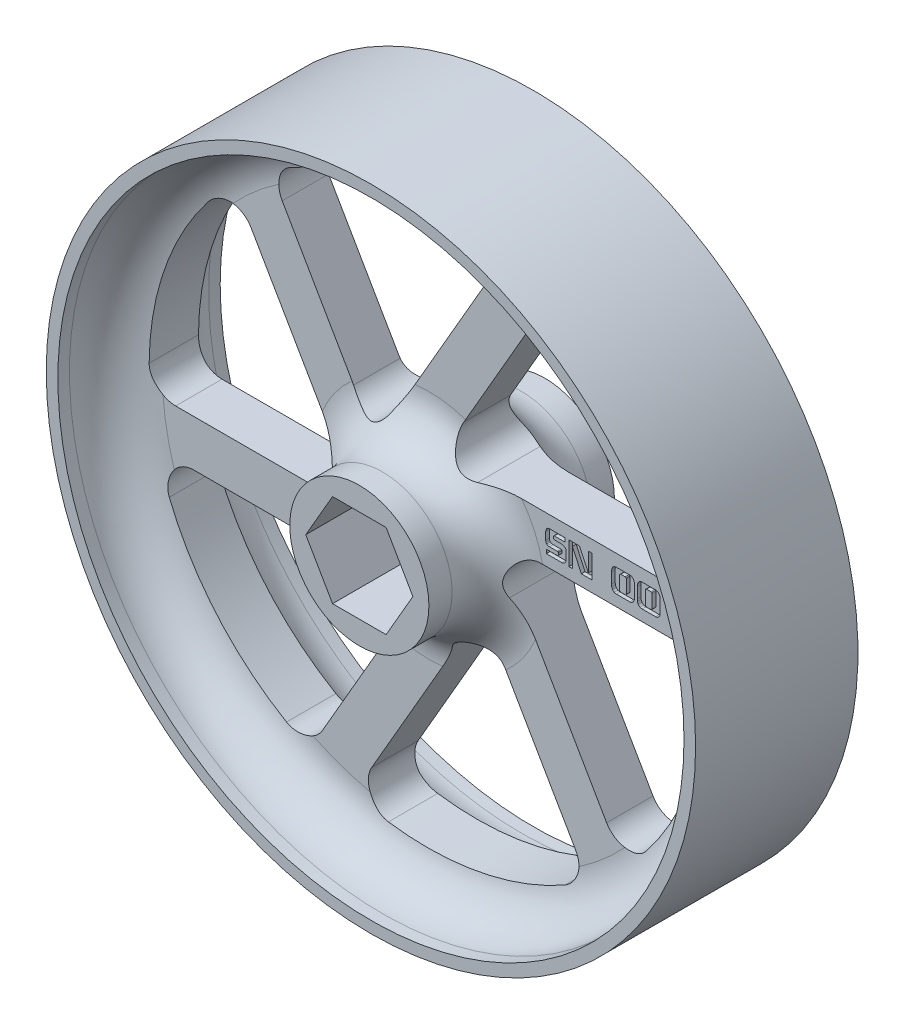
from build123d import *

# Parameters (mm, degrees)
SKETCH1_R           = 44.45
BOSS_EXTRUDE1_DEPTH = 12.7
SKETCH3_OUTSIDE_W   = 116.552
SKETCH3_OUTSIDE_H   = 116.552
SKETCH3_OUTSIDE_R   = 27.132432737
CUT_EXTRUDE1_DEPTH  = 1.5875
CUT_EXTRUDE2_DEPTH  = 65.835334695
CIRPATTERN1_COUNT   = 6
CUT_EXTRUDE3_DEPTH  = 0.508


with BuildPart() as part:
    # Sketch1 → Boss-Extrude1 (new, symmetric)
    with BuildSketch(Plane.XY):
        Circle(SKETCH1_R)
        Polygon((3.666174209, -6.35), (7.332348419, 0), (3.666174209, 6.35), (-3.666174209, 6.35), (-7.332348419, 0), (-3.666174209, -6.35), align=None, mode=Mode.SUBTRACT)
    extrude(amount=BOSS_EXTRUDE1_DEPTH, both=True)

    # Sketch2 → Cut-Revolve1 (revolve, cut)
    with BuildSketch(Plane(origin=(0, 0, 0), x_dir=(1, 0, 0), z_dir=(0, 1, 0))):
        with BuildLine():
            Line((-36.5125, 3.175), (-15.875, 3.175))
            ThreePointArc((-15.875, 3.175), (-11.384871939, 5.034871939), (-9.525, 9.525))
            Line((-9.525, 9.525), (-9.525, 12.7))
            Line((-9.525, 12.7), (-42.8625, 12.7))
            Line((-42.8625, 12.7), (-42.8625, 9.525))
            ThreePointArc((-42.8625, 9.525), (-41.002628061, 5.034871939), (-36.5125, 3.175))
        make_face()
    cut_revolve1 = revolve(axis=Axis((0, 0, 1000), (0, 0, -1)), mode=Mode.SUBTRACT)

    # Mirror1: Cut-Revolve1 across plane
    add(cut_revolve1.mirror(Plane.XY), mode=Mode.SUBTRACT)

    # Sketch3 outside → Cut-Extrude1 (cut)
    with BuildSketch(Plane.XY.offset(12.7)):
        Rectangle(SKETCH3_OUTSIDE_W, SKETCH3_OUTSIDE_H)
        Circle(SKETCH3_OUTSIDE_R, mode=Mode.SUBTRACT)
    cut_extrude1 = extrude(amount=-CUT_EXTRUDE1_DEPTH, mode=Mode.SUBTRACT)

    # Mirror2: Cut-Extrude1 across plane
    add(cut_extrude1.mirror(Plane.XY), mode=Mode.SUBTRACT)

    # Sketch4 → Cut-Extrude2 (cut, symmetric)
    with BuildSketch(Plane.XY.offset(3.175)):
        with BuildLine():
            Line((15.104637743, 3.175), (34.670069585, 3.175))
            ThreePointArc((34.670069585, 3.175), (37.103604102, 2.161771254), (38.098977565, -0.279120879))
            ThreePointArc((38.098977565, -0.279120879), (35.971949149, -12.555033829), (29.998399784, -23.488422901))
            ThreePointArc((29.998399784, -23.488422901), (27.057541118, -24.794985079), (24.328942694, -23.08896484))
            Line((24.328942694, -23.08896484), (12.135036633, -1.9685))
            ThreePointArc((12.135036633, -1.9685), (12.135036633, 1.4605), (15.104637743, 3.175))
        make_face()
    cut_extrude2 = extrude(amount=CUT_EXTRUDE2_DEPTH, both=True, mode=Mode.SUBTRACT)

    # CirPattern1: Cut-Extrude2 ×6 about axis
    cirpattern1_axis = Axis((0, 0, -1000), (0, 0, -1))
    for i in range(1, CIRPATTERN1_COUNT):
        add(cut_extrude2.rotate(cirpattern1_axis, i * 360 / CIRPATTERN1_COUNT), mode=Mode.SUBTRACT)

    # Sketch5 → Cut-Extrude3 (cut)
    # profile 1 of 5: a face of its own
    with BuildSketch(Plane.XY.offset(3.175)):
        with BuildLine():
            Line((18.656090115, 7.8603666), (18.656090115, 7.338197179))
            Line((18.656090115, 7.338197179), (17.172892801, 7.338197179))
            add(Edge.make_bspline(
                [(17.172892801, 7.338197179), (17.165602463, 7.337935526), (17.150867392, 7.337406679), (17.130305832, 7.329431218), (17.110722272, 7.319519044), (17.098885806, 7.311029967), (17.092861809, 7.306709575)],
                knots=[0, 0, 0, 0, 0.993128326, 2.007289411, 2.985838915, 4, 4, 4, 4], degree=3))
            add(Edge.make_bspline(
                [(17.092861809, 7.306709575), (17.087472204, 7.302043577), (17.076782719, 7.292789259), (17.063326985, 7.276433914), (17.054122899, 7.257046139), (17.053273913, 7.242958055), (17.052846313, 7.235862468)],
                knots=[0, 0, 0, 0, 1.012657379, 2.008456025, 2.996941486, 4, 4, 4, 4], degree=3))
            Line((17.052846313, 7.235862468), (17.052846313, 7.001673418))
            add(Edge.make_bspline(
                [(17.052846313, 7.001673418), (17.053329679, 6.995965129), (17.054292515, 6.98459457), (17.058941222, 6.967500571), (17.067992645, 6.950937734), (17.075677963, 6.940357246), (17.079741974, 6.934762261)],
                knots=[0, 0, 0, 0, 0.9352768, 1.863013687, 2.869957243, 4, 4, 4, 4], degree=3))
            add(Edge.make_bspline(
                [(17.079741974, 6.934762261), (17.08613793, 6.927807871), (17.099503814, 6.913275003), (17.122868199, 6.894856956), (17.149066938, 6.880885323), (17.167940356, 6.878713701), (17.176828751, 6.87769098)],
                knots=[0, 0, 0, 0, 0.978349812, 2.044496878, 3.079060062, 4, 4, 4, 4], degree=3))
            Line((17.176828751, 6.87769098), (18.150976479, 6.87769098))
            add(Edge.make_bspline(
                [(18.150976479, 6.87769098), (18.170904125, 6.877427204), (18.211762983, 6.876886369), (18.273361972, 6.868538165), (18.335387731, 6.859641068), (18.375425675, 6.847973305), (18.395005404, 6.842267427)],
                knots=[0, 0, 0, 0, 0.965648835, 1.979928116, 3.012125609, 4, 4, 4, 4], degree=3))
            add(Edge.make_bspline(
                [(18.395005404, 6.842267427), (18.415368684, 6.835870028), (18.455832787, 6.823157684), (18.512011312, 6.793506109), (18.566431335, 6.761396515), (18.599506316, 6.735295674), (18.616074619, 6.722220939)],
                knots=[0, 0, 0, 0, 1.0093946, 2.005779408, 3.001031929, 4, 4, 4, 4], degree=3))
            add(Edge.make_bspline(
                [(18.616074619, 6.722220939), (18.627584104, 6.710098213), (18.650644386, 6.685809246), (18.682764601, 6.647115443), (18.712869816, 6.605621116), (18.727831053, 6.574671318), (18.735465115, 6.558878997)],
                knots=[0, 0, 0, 0, 0.985997725, 1.975534637, 2.967004323, 4, 4, 4, 4], degree=3))
            add(Edge.make_bspline(
                [(18.735465115, 6.558878997), (18.742500457, 6.541980983), (18.756906647, 6.507379109), (18.769907266, 6.450927756), (18.779043929, 6.3894981), (18.779718026, 6.346596925), (18.780072553, 6.324033956)],
                knots=[0, 0, 0, 0, 0.910556491, 1.864536308, 2.876897876, 4, 4, 4, 4], degree=3))
            Line((18.780072553, 6.324033956), (18.780072553, 5.35447817))
            add(Edge.make_bspline(
                [(18.780072553, 5.35447817), (18.779781746, 5.338071984), (18.779203457, 5.305447217), (18.775762175, 5.257093888), (18.770905331, 5.209718742), (18.765190079, 5.17886068), (18.762360776, 5.163584575)],
                knots=[0, 0, 0, 0, 1.025446132, 2.039166212, 3.02930059, 4, 4, 4, 4], degree=3))
            add(Edge.make_bspline(
                [(18.762360776, 5.163584575), (18.757704072, 5.14197931), (18.748563821, 5.099572159), (18.725120214, 5.04032251), (18.700067981, 4.984428793), (18.679399324, 4.950203897), (18.66920995, 4.933331476)],
                knots=[0, 0, 0, 0, 1.060103802, 2.080788211, 3.053854009, 4, 4, 4, 4], degree=3))
            add(Edge.make_bspline(
                [(18.66920995, 4.933331476), (18.657815794, 4.916824362), (18.63515858, 4.884000058), (18.593838043, 4.840591725), (18.547698833, 4.802183396), (18.513778576, 4.780777333), (18.496684123, 4.769989534)],
                knots=[0, 0, 0, 0, 1.002750716, 1.993964127, 2.98903817, 4, 4, 4, 4], degree=3))
            add(Edge.make_bspline(
                [(18.496684123, 4.769989534), (18.473816507, 4.757712727), (18.427151758, 4.732660089), (18.350282853, 4.707625037), (18.267856197, 4.69313288), (18.211387845, 4.691033745), (18.182464082, 4.689958542)],
                knots=[0, 0, 0, 0, 0.948056558, 1.93464945, 2.942102849, 4, 4, 4, 4], degree=3))
            Line((18.182464082, 4.689958542), (16.078698586, 4.689958542))
            Line((16.078698586, 4.689958542), (16.078698586, 5.216719906))
            Line((16.078698586, 5.216719906), (17.55795995, 5.216719906))
            add(Edge.make_bspline(
                [(17.55795995, 5.216719906), (17.56674803, 5.217057421), (17.584569285, 5.217741863), (17.610848271, 5.224746204), (17.635960275, 5.235156085), (17.651838375, 5.243908022), (17.659638669, 5.248207509)],
                knots=[0, 0, 0, 0, 0.977133511, 1.981518807, 3.00839858, 4, 4, 4, 4], degree=3))
            add(Edge.make_bspline(
                [(17.659638669, 5.248207509), (17.666585733, 5.253031097), (17.680278798, 5.262538668), (17.697803147, 5.280325189), (17.710717689, 5.302329688), (17.712083291, 5.319100161), (17.712773999, 5.327582509)],
                knots=[0, 0, 0, 0, 1.01483829, 2.000304807, 2.98857294, 4, 4, 4, 4], degree=3))
            Line((17.712773999, 5.327582509), (17.712773999, 5.606378997))
            add(Edge.make_bspline(
                [(17.712773999, 5.606378997), (17.712109476, 5.613927317), (17.710726363, 5.629638118), (17.700016713, 5.651551358), (17.685742809, 5.672559002), (17.671401343, 5.681792993), (17.664230611, 5.686409989)],
                knots=[0, 0, 0, 0, 0.924252574, 1.923705996, 2.961852998, 4, 4, 4, 4], degree=3))
            add(Edge.make_bspline(
                [(17.664230611, 5.686409989), (17.658171582, 5.692101069), (17.645918205, 5.70361033), (17.622430787, 5.712684924), (17.599404839, 5.720973775), (17.583398388, 5.721553632), (17.575671726, 5.721833542)],
                knots=[0, 0, 0, 0, 1.011242726, 2.045070071, 3.056312797, 4, 4, 4, 4], degree=3))
            Line((17.575671726, 5.721833542), (16.503781231, 5.721833542))
            add(Edge.make_bspline(
                [(16.503781231, 5.721833542), (16.483625329, 5.722225758), (16.44421553, 5.722992636), (16.387505662, 5.732161769), (16.335589127, 5.743968738), (16.302801471, 5.752992091), (16.287303958, 5.757257096)],
                knots=[0, 0, 0, 0, 1.09773934, 2.146353371, 3.123849744, 4, 4, 4, 4], degree=3))
            add(Edge.make_bspline(
                [(16.287303958, 5.757257096), (16.271680205, 5.763585859), (16.241187269, 5.77593773), (16.198227875, 5.797871454), (16.160585289, 5.824321253), (16.138630903, 5.844485895), (16.127897966, 5.854343873)],
                knots=[0, 0, 0, 0, 1.075488155, 2.099034123, 3.070666432, 4, 4, 4, 4], degree=3))
            add(Edge.make_bspline(
                [(16.127897966, 5.854343873), (16.116478393, 5.866579402), (16.093829201, 5.890846935), (16.064280285, 5.931724386), (16.039724703, 5.977374554), (16.027767345, 6.010510539), (16.021627305, 6.027525691)],
                knots=[0, 0, 0, 0, 0.978603383, 1.940928607, 2.942677836, 4, 4, 4, 4], degree=3))
            add(Edge.make_bspline(
                [(16.021627305, 6.027525691), (16.015935862, 6.044028523), (16.004348332, 6.077627565), (15.995105678, 6.130956967), (15.986780063, 6.186457137), (15.986399023, 6.224504748), (15.986203751, 6.244002964)],
                knots=[0, 0, 0, 0, 0.948711643, 1.931535371, 2.939976289, 4, 4, 4, 4], degree=3))
            Line((15.986203751, 6.244002964), (15.986203751, 7.235862468))
            add(Edge.make_bspline(
                [(15.986203751, 7.235862468), (15.986551451, 7.254031323), (15.987261609, 7.291140211), (15.99424368, 7.347478055), (16.005028856, 7.405018621), (16.016062213, 7.443014802), (16.021627305, 7.462179617)],
                knots=[0, 0, 0, 0, 0.947905268, 1.936044473, 2.958965781, 4, 4, 4, 4], degree=3))
            add(Edge.make_bspline(
                [(16.021627305, 7.462179617), (16.028011807, 7.481140431), (16.040737884, 7.518934575), (16.067033014, 7.573172112), (16.097646823, 7.625012493), (16.120490222, 7.65822707), (16.131833917, 7.674720939)],
                knots=[0, 0, 0, 0, 0.997646174, 1.988584603, 3.001160754, 4, 4, 4, 4], degree=3))
            add(Edge.make_bspline(
                [(16.131833917, 7.674720939), (16.142742574, 7.687847467), (16.164730736, 7.714306105), (16.202673325, 7.750362184), (16.244161272, 7.784353899), (16.275440269, 7.802604482), (16.291239908, 7.811823212)],
                knots=[0, 0, 0, 0, 0.967104699, 1.949355842, 2.964179154, 4, 4, 4, 4], degree=3))
            add(Edge.make_bspline(
                [(16.291239908, 7.811823212), (16.307932562, 7.819007587), (16.341751951, 7.833563165), (16.396038226, 7.848139678), (16.453302601, 7.858690036), (16.492796532, 7.859799847), (16.512965115, 7.8603666)],
                knots=[0, 0, 0, 0, 0.952477468, 1.929723551, 2.942760534, 4, 4, 4, 4], degree=3))
            Line((16.512965115, 7.8603666), (18.656090115, 7.8603666))
        make_face()
    # profile 2 of 5: a face of its own
    with BuildSketch(Plane.XY.offset(3.175)):
        Polygon((19.170387636, 7.869550484), (20.618161396, 7.869550484), (21.822562222, 5.274447179), (21.822562222, 7.869550484), (22.318491974, 7.869550484), (22.318491974, 4.699142427), (20.870718214, 4.699142427), (19.648605611, 7.342133129), (19.648605611, 4.699142427), (19.170387636, 4.699142427), align=None)
    # profile 3 of 5: a face of its own
    with BuildSketch(Plane.XY.offset(3.175)):
        with BuildLine():
            Line((25.674545693, 7.869550484), (27.476554991, 7.869550484))
            add(Edge.make_bspline(
                [(27.476554991, 7.869550484), (27.502421027, 7.868922895), (27.552256648, 7.867713731), (27.623889866, 7.854837165), (27.68985485, 7.838182899), (27.731391049, 7.823495774), (27.751415528, 7.816415154)],
                knots=[0, 0, 0, 0, 1.10160964, 2.122451301, 3.094839283, 4, 4, 4, 4], degree=3))
            add(Edge.make_bspline(
                [(27.751415528, 7.816415154), (27.772702826, 7.805544073), (27.814435719, 7.784231756), (27.871020802, 7.744262684), (27.921978699, 7.69974274), (27.949990089, 7.665098997), (27.96395685, 7.647825278)],
                knots=[0, 0, 0, 0, 1.046184486, 2.051002733, 3.028210291, 4, 4, 4, 4], degree=3))
            add(Edge.make_bspline(
                [(27.96395685, 7.647825278), (27.980692884, 7.626681879), (28.014348669, 7.584162983), (28.050809258, 7.511097772), (28.081561458, 7.43631763), (28.097689517, 7.385118929), (28.105651065, 7.359844906)],
                knots=[0, 0, 0, 0, 0.998596662, 2.00815534, 3.016734276, 4, 4, 4, 4], degree=3))
            add(Edge.make_bspline(
                [(28.105651065, 7.359844906), (28.112280931, 7.333485591), (28.125493863, 7.28095303), (28.136123491, 7.201307064), (28.144205726, 7.122981176), (28.144744161, 7.071230258), (28.145010569, 7.045624865)],
                knots=[0, 0, 0, 0, 1.026289448, 2.04533437, 3.032867766, 4, 4, 4, 4], degree=3))
            Line((28.145010569, 7.045624865), (28.145010569, 5.513884162))
            add(Edge.make_bspline(
                [(28.145010569, 5.513884162), (28.144771531, 5.486310511), (28.14430206, 5.43215574), (28.136517981, 5.352909617), (28.125674721, 5.27649179), (28.11228845, 5.227762012), (28.105651065, 5.203600071)],
                knots=[0, 0, 0, 0, 1.053784012, 2.069636377, 3.042857704, 4, 4, 4, 4], degree=3))
            add(Edge.make_bspline(
                [(28.105651065, 5.203600071), (28.097556669, 5.176026458), (28.081509386, 5.12136128), (28.046545396, 5.045020031), (28.00919395, 4.97397887), (27.978659361, 4.931930287), (27.96395685, 4.911683749)],
                knots=[0, 0, 0, 0, 1.055136464, 2.09182674, 3.081207944, 4, 4, 4, 4], degree=3))
            add(Edge.make_bspline(
                [(27.96395685, 4.911683749), (27.948778159, 4.894506256), (27.918507501, 4.860249418), (27.867425087, 4.815415805), (27.813305824, 4.776844004), (27.774426574, 4.757282943), (27.755351479, 4.747685815)],
                knots=[0, 0, 0, 0, 1.027688001, 2.049504122, 3.043039762, 4, 4, 4, 4], degree=3))
            add(Edge.make_bspline(
                [(27.755351479, 4.747685815), (27.734775521, 4.738431583), (27.694046244, 4.720113205), (27.629875322, 4.701701406), (27.564550247, 4.691949656), (27.520755525, 4.690622236), (27.49885871, 4.689958542)],
                knots=[0, 0, 0, 0, 1.019831406, 2.018715103, 3.009382255, 4, 4, 4, 4], degree=3))
            Line((27.49885871, 4.689958542), (25.665361809, 4.689958542))
            add(Edge.make_bspline(
                [(25.665361809, 4.689958542), (25.640402353, 4.69082597), (25.590026059, 4.692576721), (25.514975269, 4.703362038), (25.44173785, 4.724033607), (25.396151088, 4.745514583), (25.373445487, 4.756213708)],
                knots=[0, 0, 0, 0, 0.991464485, 2.001097593, 3.004397831, 4, 4, 4, 4], degree=3))
            add(Edge.make_bspline(
                [(25.373445487, 4.756213708), (25.351671274, 4.768810687), (25.307908699, 4.794128537), (25.247725964, 4.842259546), (25.192006396, 4.89914365), (25.159751243, 4.942540436), (25.143192388, 4.964819079)],
                knots=[0, 0, 0, 0, 0.96160564, 1.932668676, 2.938692395, 4, 4, 4, 4], degree=3))
            add(Edge.make_bspline(
                [(25.143192388, 4.964819079), (25.131592151, 4.984810141), (25.107423981, 5.026459929), (25.074652006, 5.093454009), (25.046540598, 5.167939557), (25.034130381, 5.220918108), (25.027737842, 5.248207509)],
                knots=[0, 0, 0, 0, 0.90171767, 1.878657147, 2.907290292, 4, 4, 4, 4], degree=3))
            add(Edge.make_bspline(
                [(25.027737842, 5.248207509), (25.023727878, 5.270935002), (25.015569941, 5.317172193), (25.004405822, 5.388740112), (24.997805541, 5.464997613), (24.997212256, 5.517588563), (24.996906231, 5.544715774)],
                knots=[0, 0, 0, 0, 0.927488363, 1.886897834, 2.910029801, 4, 4, 4, 4], degree=3))
            Line((24.996906231, 5.544715774), (24.996906231, 7.001673418))
            add(Edge.make_bspline(
                [(24.996906231, 7.001673418), (24.997349159, 7.029906195), (24.998240461, 7.086718776), (25.007510874, 7.172092677), (25.020494089, 7.257732036), (25.034511197, 7.314015714), (25.041513669, 7.342133129)],
                knots=[0, 0, 0, 0, 0.983656752, 1.97940425, 2.990578946, 4, 4, 4, 4], degree=3))
            add(Edge.make_bspline(
                [(25.041513669, 7.342133129), (25.048330981, 7.369874716), (25.061929084, 7.425209271), (25.093090182, 7.50408337), (25.130998803, 7.577806869), (25.162962379, 7.621725171), (25.178615941, 7.643233336)],
                knots=[0, 0, 0, 0, 1.026805363, 2.048109889, 3.044098388, 4, 4, 4, 4], degree=3))
            add(Edge.make_bspline(
                [(25.178615941, 7.643233336), (25.193894377, 7.662034113), (25.22462131, 7.699844936), (25.279629884, 7.749081084), (25.342158193, 7.791759213), (25.389408806, 7.810706359), (25.413460983, 7.820351104)],
                knots=[0, 0, 0, 0, 0.973299982, 1.957433632, 2.960263909, 4, 4, 4, 4], degree=3))
            add(Edge.make_bspline(
                [(25.413460983, 7.820351104), (25.432120652, 7.827601253), (25.470930073, 7.842680517), (25.534360675, 7.856645022), (25.602639191, 7.868100505), (25.650219228, 7.869059947), (25.674545693, 7.869550484)],
                knots=[0, 0, 0, 0, 0.89743363, 1.866532442, 2.909212191, 4, 4, 4, 4], degree=3))
        make_face()
        with BuildLine():
            Line((26.861234743, 7.338197179), (26.272154164, 7.338197179))
            add(Edge.make_bspline(
                [(26.272154164, 7.338197179), (26.261534718, 7.337184049), (26.239125921, 7.335046177), (26.207230806, 7.321138983), (26.176833932, 7.302210595), (26.160728889, 7.284591837), (26.152763669, 7.275877964)],
                knots=[0, 0, 0, 0, 0.919501079, 1.94030018, 2.981315087, 4, 4, 4, 4], degree=3))
            add(Edge.make_bspline(
                [(26.152763669, 7.275877964), (26.14432782, 7.266969921), (26.127775869, 7.249491479), (26.109278312, 7.219068428), (26.09737929, 7.18619366), (26.095819754, 7.163363275), (26.095036396, 7.151895526)],
                knots=[0, 0, 0, 0, 1.046056733, 2.052464641, 3.021748949, 4, 4, 4, 4], degree=3))
            Line((26.095036396, 7.151895526), (26.095036396, 5.398429617))
            add(Edge.make_bspline(
                [(26.095036396, 5.398429617), (26.096181192, 5.386699142), (26.098531911, 5.362611842), (26.113671664, 5.328841266), (26.135084877, 5.299058423), (26.152708924, 5.282507312), (26.161291561, 5.274447179)],
                knots=[0, 0, 0, 0, 0.972714759, 1.997367838, 3.024749263, 4, 4, 4, 4], degree=3))
            add(Edge.make_bspline(
                [(26.161291561, 5.274447179), (26.170647348, 5.265995511), (26.189632346, 5.248845175), (26.222886058, 5.229891855), (26.257971323, 5.215700831), (26.28252456, 5.213737951), (26.294457884, 5.212783956)],
                knots=[0, 0, 0, 0, 1.005516545, 2.040419303, 3.047607783, 4, 4, 4, 4], degree=3))
            Line((26.294457884, 5.212783956), (26.861234743, 5.212783956))
            add(Edge.make_bspline(
                [(26.861234743, 5.212783956), (26.870278153, 5.213477382), (26.889292755, 5.214935374), (26.917464314, 5.22553113), (26.945363554, 5.24135205), (26.963047587, 5.25456543), (26.972097346, 5.261327344)],
                knots=[0, 0, 0, 0, 0.88019291, 1.850686628, 2.900094274, 4, 4, 4, 4], degree=3))
            add(Edge.make_bspline(
                [(26.972097346, 5.261327344), (26.979160486, 5.267635657), (26.99362771, 5.280556789), (27.01002977, 5.304797271), (27.022680678, 5.330847427), (27.024411318, 5.349541804), (27.025232677, 5.358414121)],
                knots=[0, 0, 0, 0, 0.994075136, 2.036135028, 3.067953297, 4, 4, 4, 4], degree=3))
            Line((27.025232677, 5.358414121), (27.025232677, 7.191911022))
            add(Edge.make_bspline(
                [(27.025232677, 7.191911022), (27.02444898, 7.200801316), (27.022815399, 7.219332719), (27.009642955, 7.245087604), (26.993870965, 7.269717327), (26.979195927, 7.282712028), (26.972097346, 7.288997798)],
                knots=[0, 0, 0, 0, 0.932541057, 1.943838352, 3.00539761, 4, 4, 4, 4], degree=3))
            add(Edge.make_bspline(
                [(26.972097346, 7.288997798), (26.963121978, 7.296107828), (26.945762152, 7.309859784), (26.917110251, 7.324450627), (26.889451636, 7.336249502), (26.870305361, 7.337571077), (26.861234743, 7.338197179)],
                knots=[0, 0, 0, 0, 1.109783635, 2.146502468, 3.121898788, 4, 4, 4, 4], degree=3))
        make_face(mode=Mode.SUBTRACT)
    # profile 4 of 5: a face of its own
    with BuildSketch(Plane.XY.offset(3.175)):
        with BuildLine():
            Line((29.201157264, 7.869550484), (31.003166561, 7.869550484))
            add(Edge.make_bspline(
                [(31.003166561, 7.869550484), (31.029032597, 7.868922895), (31.078868218, 7.867713731), (31.150501436, 7.854837165), (31.21646642, 7.838182899), (31.258002619, 7.823495774), (31.278027098, 7.816415154)],
                knots=[0, 0, 0, 0, 1.10160964, 2.122451301, 3.094839283, 4, 4, 4, 4], degree=3))
            add(Edge.make_bspline(
                [(31.278027098, 7.816415154), (31.299314396, 7.805544073), (31.34104729, 7.784231756), (31.397632372, 7.744262684), (31.448590269, 7.69974274), (31.476601659, 7.665098997), (31.490568421, 7.647825278)],
                knots=[0, 0, 0, 0, 1.046184486, 2.051002733, 3.028210291, 4, 4, 4, 4], degree=3))
            add(Edge.make_bspline(
                [(31.490568421, 7.647825278), (31.507304454, 7.626681879), (31.540960239, 7.584162983), (31.577420829, 7.511097772), (31.608173028, 7.43631763), (31.624301087, 7.385118929), (31.632262636, 7.359844906)],
                knots=[0, 0, 0, 0, 0.998596662, 2.00815534, 3.016734276, 4, 4, 4, 4], degree=3))
            add(Edge.make_bspline(
                [(31.632262636, 7.359844906), (31.638892501, 7.333485591), (31.652105433, 7.28095303), (31.662735061, 7.201307064), (31.670817296, 7.122981176), (31.671355732, 7.071230258), (31.67162214, 7.045624865)],
                knots=[0, 0, 0, 0, 1.026289448, 2.04533437, 3.032867766, 4, 4, 4, 4], degree=3))
            Line((31.67162214, 7.045624865), (31.67162214, 5.513884162))
            add(Edge.make_bspline(
                [(31.67162214, 5.513884162), (31.671383102, 5.486310511), (31.67091363, 5.43215574), (31.663129552, 5.352909617), (31.652286292, 5.27649179), (31.63890002, 5.227762012), (31.632262636, 5.203600071)],
                knots=[0, 0, 0, 0, 1.053784012, 2.069636377, 3.042857704, 4, 4, 4, 4], degree=3))
            add(Edge.make_bspline(
                [(31.632262636, 5.203600071), (31.62416824, 5.176026458), (31.608120956, 5.12136128), (31.573156966, 5.045020031), (31.53580552, 4.97397887), (31.505270931, 4.931930287), (31.490568421, 4.911683749)],
                knots=[0, 0, 0, 0, 1.055136464, 2.09182674, 3.081207944, 4, 4, 4, 4], degree=3))
            add(Edge.make_bspline(
                [(31.490568421, 4.911683749), (31.475389729, 4.894506256), (31.445119071, 4.860249418), (31.394036657, 4.815415805), (31.339917394, 4.776844004), (31.301038145, 4.757282943), (31.281963049, 4.747685815)],
                knots=[0, 0, 0, 0, 1.027688001, 2.049504122, 3.043039762, 4, 4, 4, 4], degree=3))
            add(Edge.make_bspline(
                [(31.281963049, 4.747685815), (31.261387091, 4.738431583), (31.220657815, 4.720113205), (31.156486892, 4.701701406), (31.091161817, 4.691949656), (31.047367095, 4.690622236), (31.02547028, 4.689958542)],
                knots=[0, 0, 0, 0, 1.019831406, 2.018715103, 3.009382255, 4, 4, 4, 4], degree=3))
            Line((31.02547028, 4.689958542), (29.191973379, 4.689958542))
            add(Edge.make_bspline(
                [(29.191973379, 4.689958542), (29.167013924, 4.69082597), (29.116637629, 4.692576721), (29.04158684, 4.703362038), (28.968349421, 4.724033607), (28.922762658, 4.745514583), (28.900057057, 4.756213708)],
                knots=[0, 0, 0, 0, 0.991464485, 2.001097593, 3.004397831, 4, 4, 4, 4], degree=3))
            add(Edge.make_bspline(
                [(28.900057057, 4.756213708), (28.878282844, 4.768810687), (28.834520269, 4.794128537), (28.774337534, 4.842259546), (28.718617966, 4.89914365), (28.686362813, 4.942540436), (28.669803958, 4.964819079)],
                knots=[0, 0, 0, 0, 0.96160564, 1.932668676, 2.938692395, 4, 4, 4, 4], degree=3))
            add(Edge.make_bspline(
                [(28.669803958, 4.964819079), (28.658203722, 4.984810141), (28.634035551, 5.026459929), (28.601263576, 5.093454009), (28.573152169, 5.167939557), (28.560741951, 5.220918108), (28.554349412, 5.248207509)],
                knots=[0, 0, 0, 0, 0.90171767, 1.878657147, 2.907290292, 4, 4, 4, 4], degree=3))
            add(Edge.make_bspline(
                [(28.554349412, 5.248207509), (28.550339449, 5.270935002), (28.542181511, 5.317172193), (28.531017393, 5.388740112), (28.524417111, 5.464997613), (28.523823826, 5.517588563), (28.523517801, 5.544715774)],
                knots=[0, 0, 0, 0, 0.927488363, 1.886897834, 2.910029801, 4, 4, 4, 4], degree=3))
            Line((28.523517801, 5.544715774), (28.523517801, 7.001673418))
            add(Edge.make_bspline(
                [(28.523517801, 7.001673418), (28.52396073, 7.029906195), (28.524852031, 7.086718776), (28.534122445, 7.172092677), (28.547105659, 7.257732036), (28.561122767, 7.314015714), (28.568125239, 7.342133129)],
                knots=[0, 0, 0, 0, 0.983656752, 1.97940425, 2.990578946, 4, 4, 4, 4], degree=3))
            add(Edge.make_bspline(
                [(28.568125239, 7.342133129), (28.574942551, 7.369874716), (28.588540654, 7.425209271), (28.619701752, 7.50408337), (28.657610373, 7.577806869), (28.689573949, 7.621725171), (28.705227512, 7.643233336)],
                knots=[0, 0, 0, 0, 1.026805363, 2.048109889, 3.044098388, 4, 4, 4, 4], degree=3))
            add(Edge.make_bspline(
                [(28.705227512, 7.643233336), (28.720505947, 7.662034113), (28.75123288, 7.699844936), (28.806241454, 7.749081084), (28.868769764, 7.791759213), (28.916020376, 7.810706359), (28.940072553, 7.820351104)],
                knots=[0, 0, 0, 0, 0.973299982, 1.957433632, 2.960263909, 4, 4, 4, 4], degree=3))
            add(Edge.make_bspline(
                [(28.940072553, 7.820351104), (28.958732223, 7.827601253), (28.997541643, 7.842680517), (29.060972245, 7.856645022), (29.129250762, 7.868100505), (29.176830798, 7.869059947), (29.201157264, 7.869550484)],
                knots=[0, 0, 0, 0, 0.89743363, 1.866532442, 2.909212191, 4, 4, 4, 4], degree=3))
        make_face()
        with BuildLine():
            Line((30.387846313, 7.338197179), (29.798765735, 7.338197179))
            add(Edge.make_bspline(
                [(29.798765735, 7.338197179), (29.788146288, 7.337184049), (29.765737491, 7.335046177), (29.733842376, 7.321138983), (29.703445502, 7.302210595), (29.68734046, 7.284591837), (29.679375239, 7.275877964)],
                knots=[0, 0, 0, 0, 0.919501079, 1.94030018, 2.981315087, 4, 4, 4, 4], degree=3))
            add(Edge.make_bspline(
                [(29.679375239, 7.275877964), (29.670939391, 7.266969921), (29.654387439, 7.249491479), (29.635889882, 7.219068428), (29.623990861, 7.18619366), (29.622431324, 7.163363275), (29.621647966, 7.151895526)],
                knots=[0, 0, 0, 0, 1.046056733, 2.052464641, 3.021748949, 4, 4, 4, 4], degree=3))
            Line((29.621647966, 7.151895526), (29.621647966, 5.398429617))
            add(Edge.make_bspline(
                [(29.621647966, 5.398429617), (29.622792762, 5.386699142), (29.625143482, 5.362611842), (29.640283234, 5.328841266), (29.661696447, 5.299058423), (29.679320494, 5.282507312), (29.687903131, 5.274447179)],
                knots=[0, 0, 0, 0, 0.972714759, 1.997367838, 3.024749263, 4, 4, 4, 4], degree=3))
            add(Edge.make_bspline(
                [(29.687903131, 5.274447179), (29.697258919, 5.265995511), (29.716243916, 5.248845175), (29.749497628, 5.229891855), (29.784582894, 5.215700831), (29.80913613, 5.213737951), (29.821069454, 5.212783956)],
                knots=[0, 0, 0, 0, 1.005516545, 2.040419303, 3.047607783, 4, 4, 4, 4], degree=3))
            Line((29.821069454, 5.212783956), (30.387846313, 5.212783956))
            add(Edge.make_bspline(
                [(30.387846313, 5.212783956), (30.396889723, 5.213477382), (30.415904326, 5.214935374), (30.444075885, 5.22553113), (30.471975125, 5.24135205), (30.489659157, 5.25456543), (30.498708917, 5.261327344)],
                knots=[0, 0, 0, 0, 0.88019291, 1.850686628, 2.900094274, 4, 4, 4, 4], degree=3))
            add(Edge.make_bspline(
                [(30.498708917, 5.261327344), (30.505772057, 5.267635657), (30.52023928, 5.280556789), (30.536641341, 5.304797271), (30.549292248, 5.330847427), (30.551022888, 5.349541804), (30.551844247, 5.358414121)],
                knots=[0, 0, 0, 0, 0.994075136, 2.036135028, 3.067953297, 4, 4, 4, 4], degree=3))
            Line((30.551844247, 5.358414121), (30.551844247, 7.191911022))
            add(Edge.make_bspline(
                [(30.551844247, 7.191911022), (30.55106055, 7.200801316), (30.54942697, 7.219332719), (30.536254525, 7.245087604), (30.520482536, 7.269717327), (30.505807497, 7.282712028), (30.498708917, 7.288997798)],
                knots=[0, 0, 0, 0, 0.932541057, 1.943838352, 3.00539761, 4, 4, 4, 4], degree=3))
            add(Edge.make_bspline(
                [(30.498708917, 7.288997798), (30.489733548, 7.296107828), (30.472373722, 7.309859784), (30.443721821, 7.324450627), (30.416063206, 7.336249502), (30.396916931, 7.337571077), (30.387846313, 7.338197179)],
                knots=[0, 0, 0, 0, 1.109783635, 2.146502468, 3.121898788, 4, 4, 4, 4], degree=3))
        make_face(mode=Mode.SUBTRACT)
    # profile 5 of 5: a face of its own
    with BuildSketch(Plane.XY.offset(3.175)):
        Polygon((34.188662429, 7.869550484), (34.188662429, 4.699142427), (33.090532264, 4.699142427), (33.090532264, 6.899338708), (32.683161396, 6.899338708), (32.683161396, 7.462179617), (33.927577718, 7.869550484), align=None)
    extrude(amount=-CUT_EXTRUDE3_DEPTH, mode=Mode.SUBTRACT)


solid = part.part
